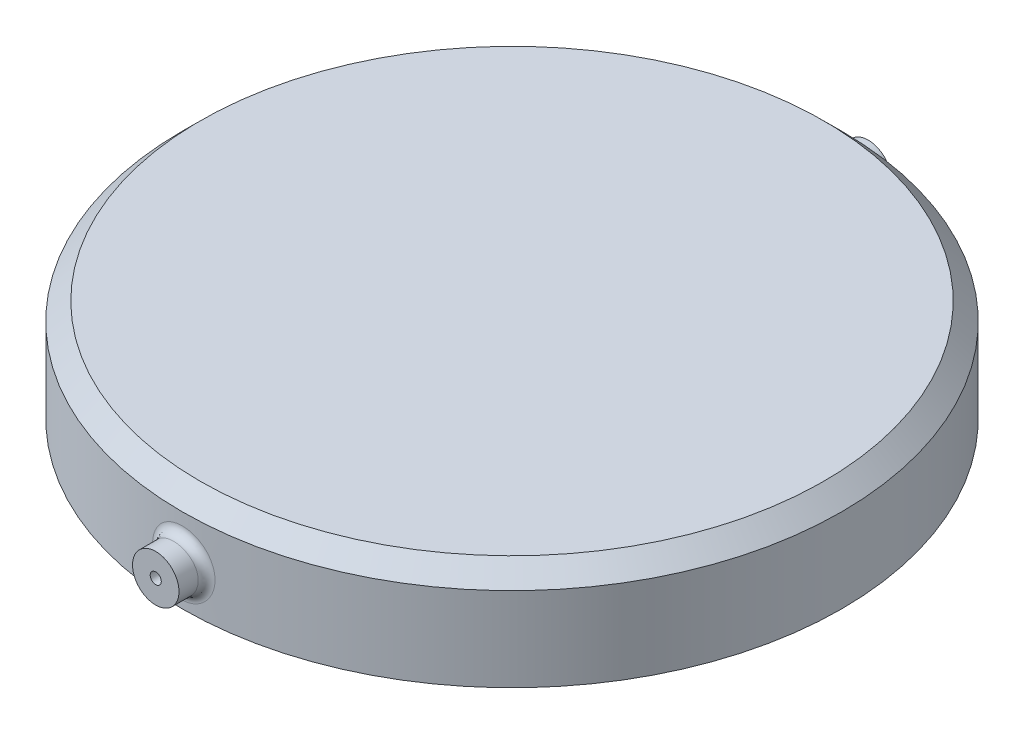
from build123d import *

# Parameters (mm, degrees)
SKETCH1_R           = 37.25
SKETCH1_R_2         = 35.5
BOSS_EXTRUDE1_DEPTH = 10
BOSS_EXTRUDE2_START = 1.5
SKETCH1_2_R         = 37.25
BOSS_EXTRUDE2_DEPTH = 1.5
CHAMFER1_SIZE       = 1.5
CHAMFER2_SIZE       = 2
SKETCH2_R           = 0.625
CUT_EXTRUDE1_DEPTH  = 10
BOSS_EXTRUDE4_START = 3
SKETCH2_3_R         = 2.625
SKETCH2_3_R_2       = 0.625
BOSS_EXTRUDE4_DEPTH = 4
FILLET1_R           = 1


with BuildPart() as part:
    # Sketch1 → Boss-Extrude1 (new body)
    with BuildSketch(Plane(origin=(0, 0, 0), x_dir=(1, 0, 0), z_dir=(0, 1, 0))):
        Circle(SKETCH1_R)
        Circle(SKETCH1_R_2, mode=Mode.SUBTRACT)
    extrude(amount=-BOSS_EXTRUDE1_DEPTH)

    # Sketch1<2> → Boss-Extrude2 (add)
    with BuildSketch(Plane(origin=(0, 0, 0), x_dir=(1, 0, 0), z_dir=(0, 1, 0)).offset(BOSS_EXTRUDE2_START)):
        Circle(SKETCH1_2_R)
    extrude(amount=-BOSS_EXTRUDE2_DEPTH)

    # Chamfer1
    chamfer1_edges = [part.edges().sort_by_distance(p)[0] for p in [
        (-35.5, 0, 0),
    ]]
    chamfer(chamfer1_edges, length=CHAMFER1_SIZE)

    # Chamfer2
    chamfer2_edges = [part.edges().sort_by_distance(p)[0] for p in [
        (-37.25, 1.5, 0),
    ]]
    chamfer(chamfer2_edges, length=CHAMFER2_SIZE)

    # Sketch2 → Cut-Extrude1 (cut)
    with BuildSketch(Plane.XY.offset(37.25)):
        with Locations((0, -5.5)):
            Circle(SKETCH2_R)
    cut_extrude1 = extrude(amount=-CUT_EXTRUDE1_DEPTH, mode=Mode.SUBTRACT)

    # Sketch2<3> → Boss-Extrude4 (add)
    with BuildSketch(Plane.XY.offset(37.25).offset(BOSS_EXTRUDE4_START)):
        with Locations((0, -5.5)):
            Circle(SKETCH2_3_R)
        with Locations((0, -5.5)):
            Circle(SKETCH2_3_R_2, mode=Mode.SUBTRACT)
    boss_extrude4 = extrude(amount=-BOSS_EXTRUDE4_DEPTH)

    # Mirror1: Cut-Extrude1, Boss-Extrude4 across plane
    add(cut_extrude1.mirror(Plane.XY), mode=Mode.SUBTRACT)
    add(boss_extrude4.mirror(Plane.XY))

    # Fillet1
    fillet1_edges = [part.edges().sort_by_distance(p)[0] for p in [
        (-2.625, -5.5, -37.157393275),
        (-2.624999999, -5.5, 37.157393276),
    ]]
    fillet(fillet1_edges, radius=FILLET1_R)


solid = part.part
